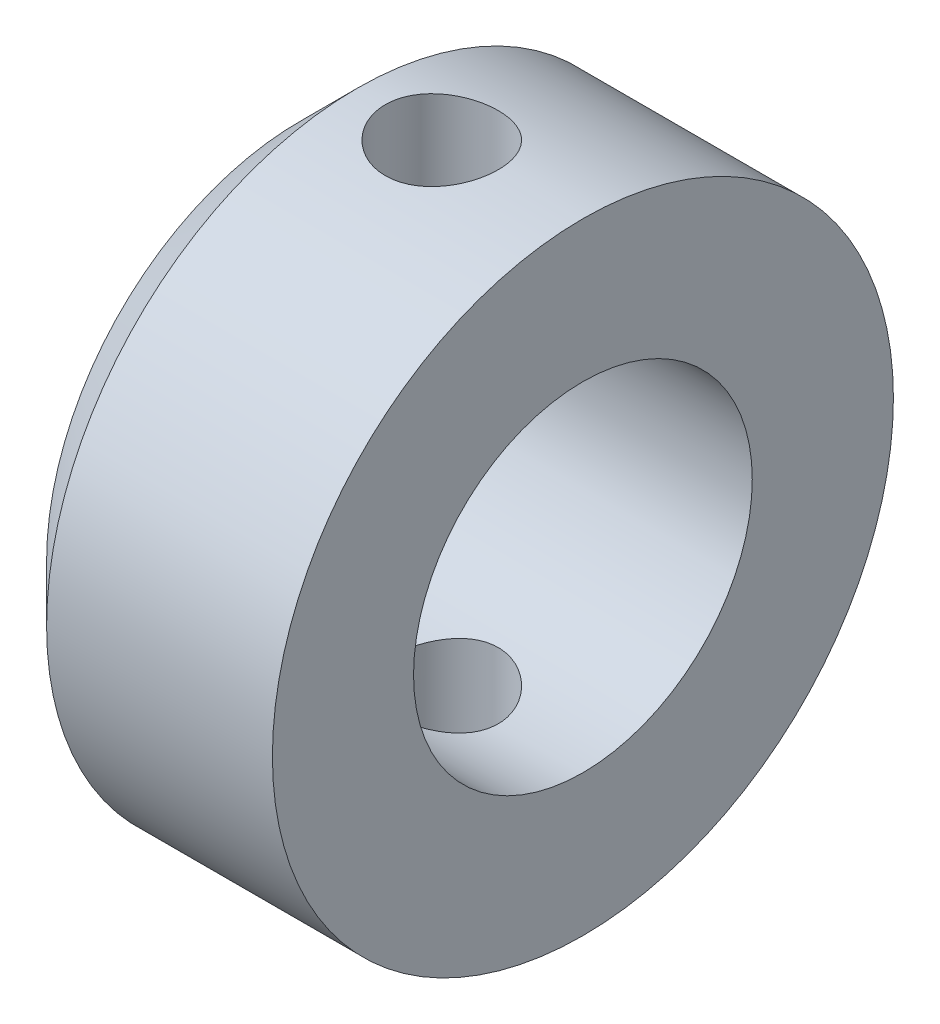
from build123d import *

# Parameters (mm, degrees)
SKETCH_1_W               = 10
SKETCH_1_H               = 11
CHAMFER_1_SIZE           = 2
SKETCH_2_R               = 6
CUT_EXTRUDE_1_DEPTH      = 19.493242009
CUT_EXTRUDE_2_DEPTH      = 19.493242009
CUT_EXTRUDE_2_DEPTH_BACK = 19.493242009
SKETCH_3_R               = 2


with BuildPart() as part:
    # 草图1 → 旋转1 (revolve)
    with BuildSketch(Plane.XY):
        with Locations((-5, 5.5)):
            Rectangle(SKETCH_1_W, SKETCH_1_H)
    revolve(axis=Axis((0, 0, 0), (-1, 0, 0)))

    # 倒角1
    chamfer_1_edges = [part.edges().sort_by_distance(p)[0] for p in [
        (-10, -11, 0),
    ]]
    chamfer(chamfer_1_edges, length=CHAMFER_1_SIZE)

    # 草图2 → 切除-拉伸1 (cut, through all)
    with BuildSketch(Plane.ZY.offset(10)):
        Circle(SKETCH_2_R)
    extrude(amount=-CUT_EXTRUDE_1_DEPTH, mode=Mode.SUBTRACT)

    # 草图3 → 切除-拉伸2 (cut, two sides: drawn at the far end of the back side and taken through both)
    with BuildSketch(Plane(origin=(0, 0, 0), x_dir=(1, 0, 0), z_dir=(0, 1, 0)).offset(-CUT_EXTRUDE_2_DEPTH_BACK)):
        with Locations((-5, 0)):
            Circle(SKETCH_3_R)
    extrude(amount=CUT_EXTRUDE_2_DEPTH + CUT_EXTRUDE_2_DEPTH_BACK, mode=Mode.SUBTRACT)


solid = part.part
